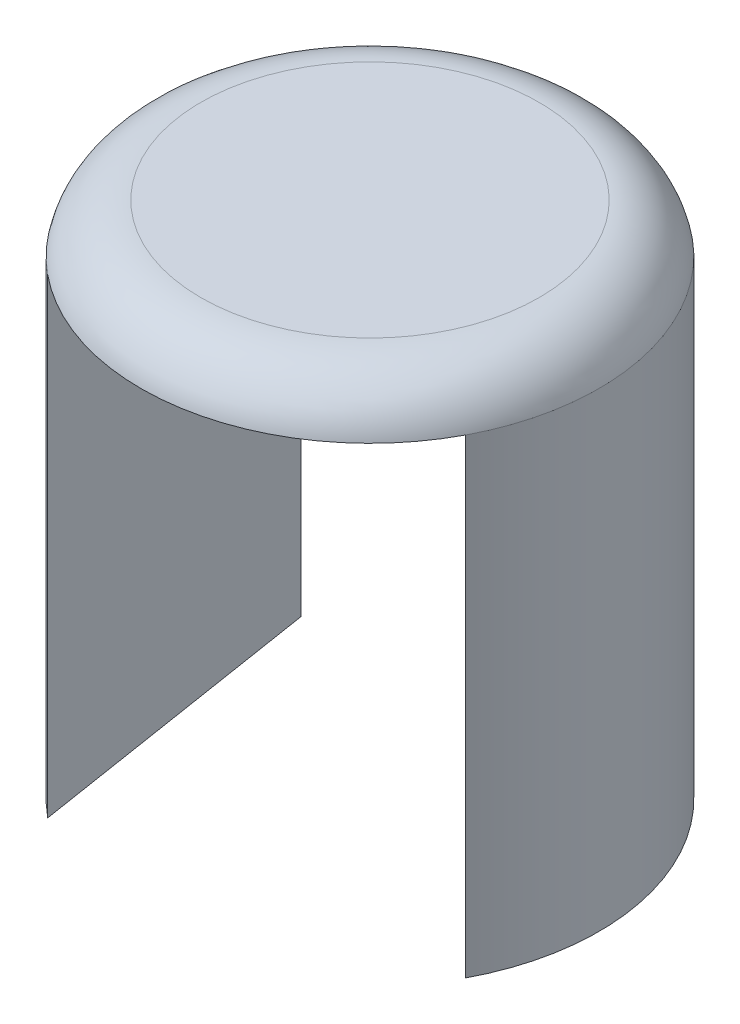
from build123d import *

# Parameters (mm, degrees)
SKETCH1_R           = 37.5
BOSS_EXTRUDE1_DEPTH = 8
FILLET1_R           = 10
BOSS_EXTRUDE3_DEPTH = 77


with BuildPart() as part:
    # Sketch1 → Boss-Extrude1 (new body)
    with BuildSketch(Plane(origin=(0, 0, 0), x_dir=(1, 0, 0), z_dir=(0, 1, 0))):
        with Locations(Location((0, 0, 0), (0, 0, 270))):
            Circle(SKETCH1_R)
    extrude(amount=BOSS_EXTRUDE1_DEPTH)

    # Fillet1
    # the kernel refuses this fillet: 10 mm, written as the material it takes off along each edge
    with BuildSketch(Plane(origin=(0, 8, 0), x_dir=(0, 0, 1), z_dir=(-1, 0, 0))) as fillet1_piece_1:
        with BuildLine():
            CenterArc((27.702041029, -10), FILLET1_R, 11.536959033, 78.463040967)
            Line((27.702041029, 0), (27.702041029, 0.2))
            Line((27.702041029, 0.2), (37.5, 0.2))
            Line((37.5, 0.2), (37.7, 0))
            ThreePointArc((37.7, 0), (37.7, -4), (37.695959179, -7.96))
            Line((37.695959179, -7.96), (37.5, -8))
        make_face()
    revolve(axis=Axis((0, 8, 0), (0, 1, 0)), mode=Mode.SUBTRACT)

    # Sketch3 → Boss-Extrude3 (add)
    with BuildSketch(Plane.XZ):
        with BuildLine():
            Line((-31.557930538, -20.257023971), (-23.752439757, 29.018470077))
            ThreePointArc((-23.752439757, 29.018470077), (-37.038194394, 5.867039803), (-31.557930538, -20.257023971))
        make_face()
        with BuildLine():
            ThreePointArc((37.5, 0), (36.396457433, 9.03038683), (33.150779397, 17.529284794))
            Line((33.150779397, 17.529284794), (26.110331633, -26.916548479))
            ThreePointArc((26.110331633, -26.916548479), (34.535398045, -14.613564996), (37.5, 0))
        make_face()
    extrude(amount=BOSS_EXTRUDE3_DEPTH)


solid = part.part
